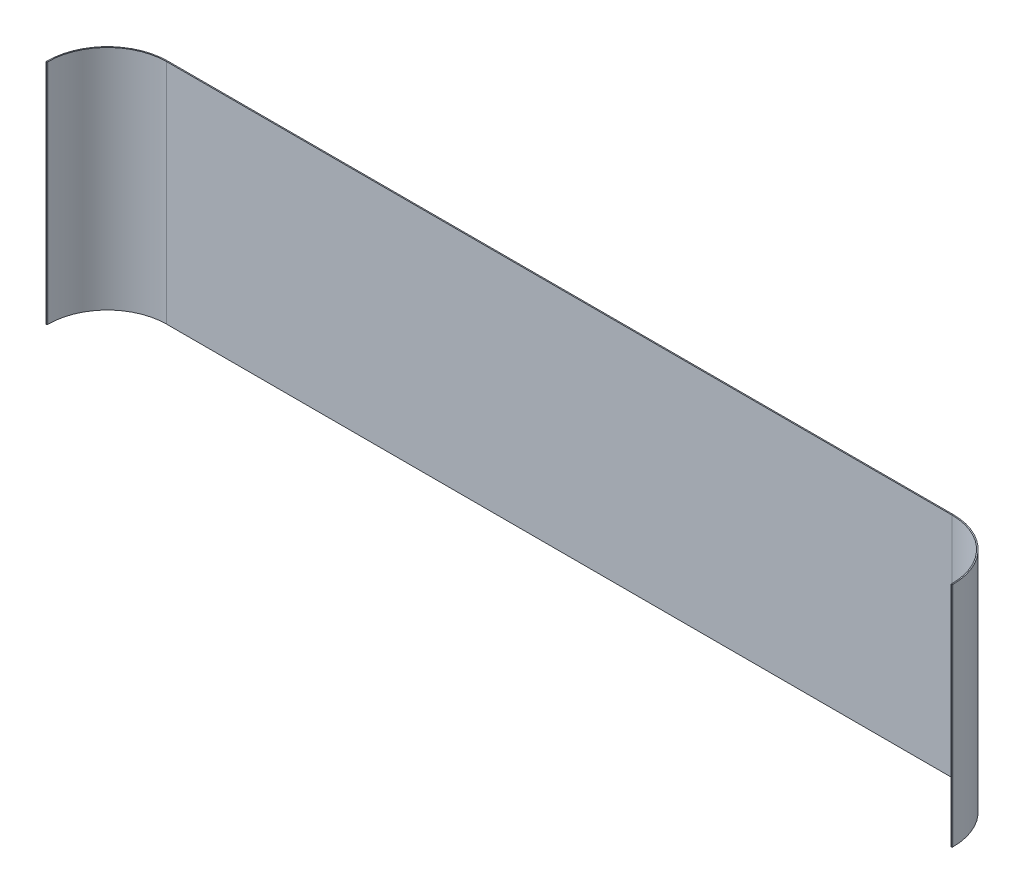
from build123d import *

# Parameters (mm, degrees)
BASE_FLANGE1_DEPTH = 249


# Sheet-metal steps are written as plain solids
with BuildPart() as part:
    # Sketch1 → Base-Flange1 (new body)
    with BuildSketch(Plane(origin=(0, 0, 0), x_dir=(1, 0, 0), z_dir=(0, 1, 0))):
        with BuildLine():
            Line((-495, -33), (-495, -32))
            ThreePointArc((-495, -32), (-475.961940777, 13.961940777), (-430, 33))
            Line((-430, 33), (430, 33))
            ThreePointArc((430, 33), (475.961940777, 13.961940777), (495, -32))
            Line((495, -32), (495, -33))
            Line((495, -33), (496.2, -33))
            Line((496.2, -33), (496.2, -32))
            ThreePointArc((496.2, -32), (476.810468915, 14.810468915), (430, 34.2))
            Line((430, 34.2), (-430, 34.2))
            ThreePointArc((-430, 34.2), (-476.810468915, 14.810468915), (-496.2, -32))
            Line((-496.2, -32), (-496.2, -33))
            Line((-496.2, -33), (-495, -33))
        make_face()
    extrude(amount=BASE_FLANGE1_DEPTH)


solid = part.part
